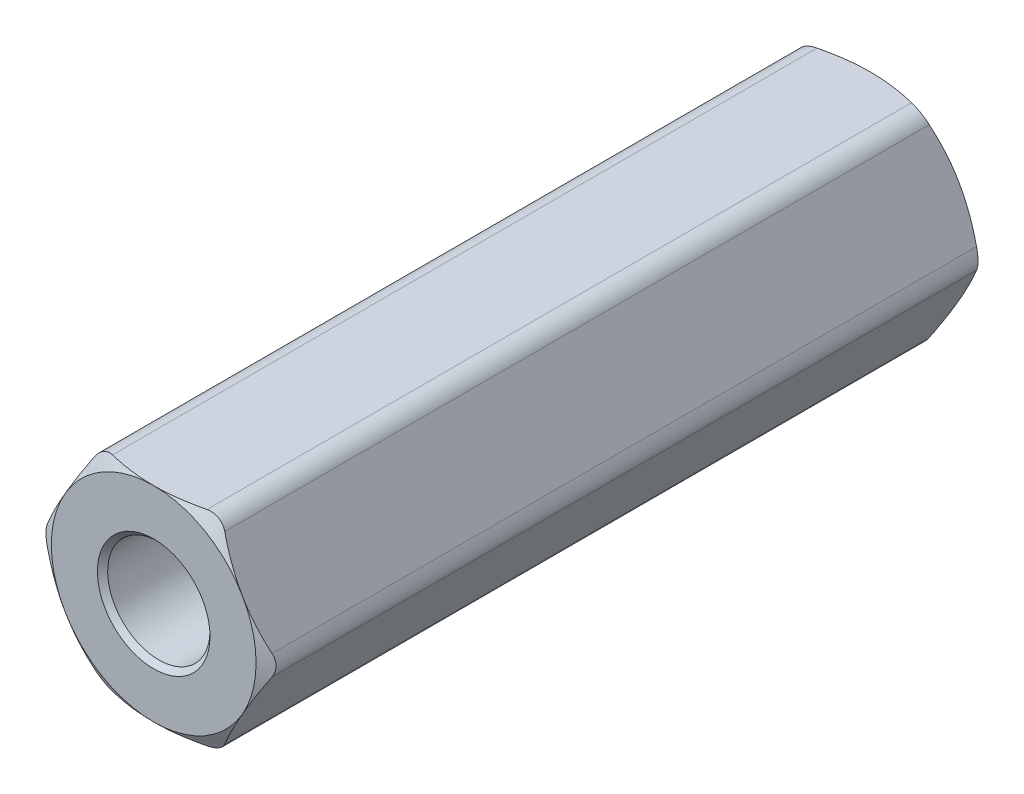
from build123d import *

# Parameters (mm, degrees)
SKETCH4_R           = 4.7625
BOSS_EXTRUDE1_DEPTH = 22.225
SKETCH5_OUTSIDE_W   = 187.43
SKETCH5_OUTSIDE_H   = 185.466
SKETCH5_OUTSIDE_R   = 6.35
CUT_EXTRUDE1_DEPTH  = 46.496025467
CUT_EXTRUDE1_DRAFT  = -60
SKETCH6_OUTSIDE_W   = 187.43
SKETCH6_OUTSIDE_H   = 185.466
SKETCH6_OUTSIDE_R   = 6.35
CUT_EXTRUDE2_DEPTH  = 46.496025467
CUT_EXTRUDE2_DRAFT  = -60
FILLET1_R           = 1.27


with BuildPart() as part:
    # Sketch3 → Revolve1 (revolve)
    with BuildSketch(Plane(origin=(0, 0, 0), x_dir=(0, 0, -1), z_dir=(1, 0, 0))):
        Polygon((-21.9075, 3.175), (-6.35, 3.175), (-6.35, 0), (6.35, 0), (6.35, 3.175), (22.225, 3.175), (22.225, 6.35), (0, 6.35), (-22.225, 6.35), (-22.225, 3.4925), align=None)
        Polygon((-21.9075, 3.175), (-6.35, 3.175), (-6.35, 0), (6.35, 0), (6.35, 3.175), (22.225, 3.175), (22.225, 6.35), (0, 6.35), (-22.225, 6.35), (-22.225, 3.4925), align=None)
    revolve(axis=Axis((0, 0, 6.35), (0, 0, 1)))

    # Sketch4 → Boss-Extrude1 (add, symmetric)
    with BuildSketch(Plane.XY):
        Polygon((-3.666174209, 6.35), (-7.332348419, 0), (-3.666174209, -6.35), (3.666174209, -6.35), (7.332348419, 0), (3.666174209, 6.35), align=None)
        Circle(SKETCH4_R, mode=Mode.SUBTRACT)
    extrude(amount=BOSS_EXTRUDE1_DEPTH, both=True)


with BuildPart() as cut_extrude1_tool:
    # Sketch5 outside → Cut-Extrude1 (with draft: the straight prism first)
    with BuildSketch(Plane.XY.offset(22.225)):
        Rectangle(SKETCH5_OUTSIDE_W, SKETCH5_OUTSIDE_H)
        Circle(SKETCH5_OUTSIDE_R, mode=Mode.SUBTRACT)
    extrude(amount=-CUT_EXTRUDE1_DEPTH)
    # Cut-Extrude1: the draft: its side faces are tilted about the plane it starts from
    cut_extrude1_sides = [cut_extrude1_tool.faces().sort_by_distance(p)[0] for p in [
        (0, -92.733, -1.023012734),
        (93.715, 0, -1.023012734),
        (0, 92.733, -1.023012734),
        (-93.715, 0, -1.023012734),
        (-6.35, 0, -1.023012734),
    ]]
    draft(cut_extrude1_sides, Plane.XY.offset(22.225), CUT_EXTRUDE1_DRAFT)


with BuildPart() as part_1:
    add(part.part)

    # Cut-Extrude1: cut by cut_extrude1_tool
    add(cut_extrude1_tool.part, mode=Mode.SUBTRACT)


with BuildPart() as cut_extrude2_tool:
    # Sketch6 outside → Cut-Extrude2 (with draft: the straight prism first)
    with BuildSketch(Plane(origin=(0, 0, -22.225), x_dir=(-1, 0, 0), z_dir=(0, 0, -1))):
        Rectangle(SKETCH6_OUTSIDE_W, SKETCH6_OUTSIDE_H)
        Circle(SKETCH6_OUTSIDE_R, mode=Mode.SUBTRACT)
    extrude(amount=-CUT_EXTRUDE2_DEPTH)
    # Cut-Extrude2: the draft: its side faces are tilted about the plane it starts from
    cut_extrude2_sides = [cut_extrude2_tool.faces().sort_by_distance(p)[0] for p in [
        (0, -92.733, 1.023012734),
        (-93.715, 0, 1.023012734),
        (0, 92.733, 1.023012734),
        (93.715, 0, 1.023012734),
        (6.35, 0, 1.023012734),
    ]]
    draft(cut_extrude2_sides, Plane(origin=(0, 0, -22.225), x_dir=(-1, 0, 0), z_dir=(0, 0, -1)), CUT_EXTRUDE2_DRAFT)


with BuildPart() as part_2:
    add(part_1.part)

    # Cut-Extrude2: cut by cut_extrude2_tool
    add(cut_extrude2_tool.part, mode=Mode.SUBTRACT)

    # Fillet1
    fillet1_edges = [part_2.edges().sort_by_distance(p)[0] for p in [
        (3.666174209, 6.35, 0),
        (-7.332348419, 0, 0),
        (-3.666174209, -6.35, 0),
        (3.666174209, -6.35, 0),
        (7.332348419, 0, 0),
        (-3.666174209, 6.35, 0),
    ]]
    fillet(fillet1_edges, radius=FILLET1_R)


solid = part_2.part
